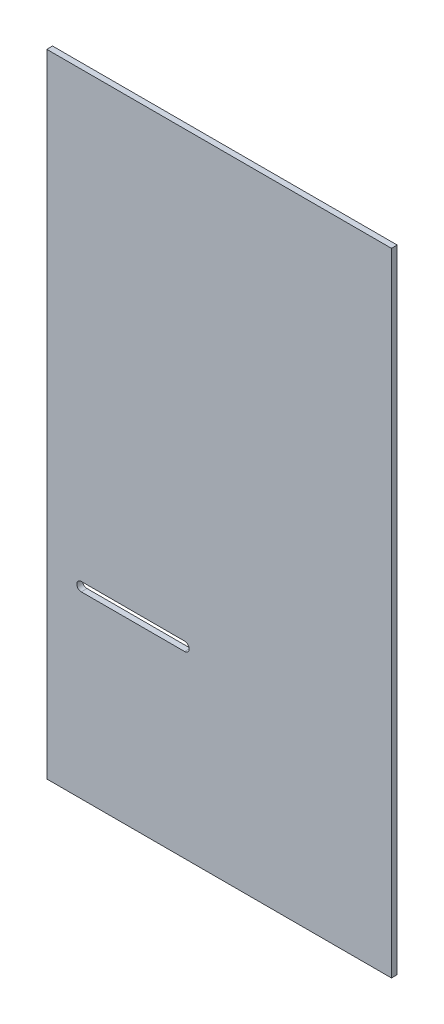
from build123d import *

# Parameters (mm, degrees)
SKETCH1_W           = 349.25
SKETCH1_H           = 190.5
BOSS_EXTRUDE1_DEPTH = 3.175
CUT_EXTRUDE1_DEPTH  = 199.938517512


with BuildPart() as part:
    # Sketch1 → Boss-Extrude1 (new body)
    with BuildSketch(Plane(origin=(0, 0, 0), x_dir=(0, 1, 0), z_dir=(0, 0, 1))):
        Rectangle(SKETCH1_W, SKETCH1_H)
    extrude(amount=BOSS_EXTRUDE1_DEPTH)

    # Sketch2 → Cut-Extrude1 (cut, through all)
    with BuildSketch(Plane.XY.offset(3.175)):
        with BuildLine():
            Line((-76.2, -75.5142), (-19.05, -75.5142))
            ThreePointArc((-19.05, -75.5142), (-16.5608, -73.025), (-19.05, -70.5358))
            Line((-19.05, -70.5358), (-76.2, -70.5358))
            ThreePointArc((-76.2, -70.5358), (-78.6892, -73.025), (-76.2, -75.5142))
        make_face()
    extrude(amount=-CUT_EXTRUDE1_DEPTH, mode=Mode.SUBTRACT)


solid = part.part
